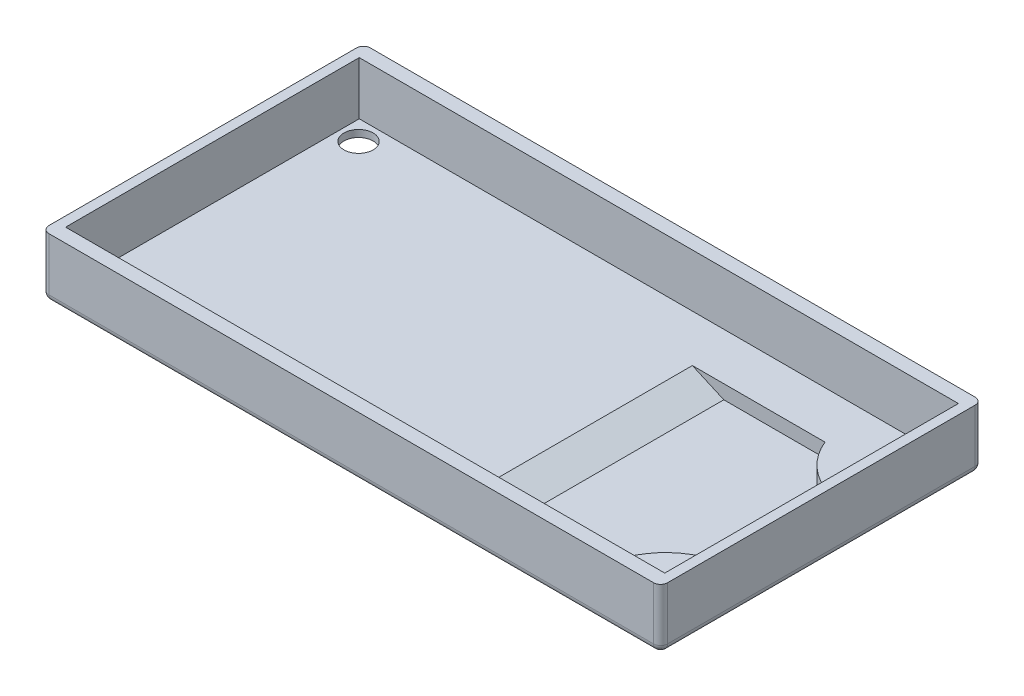
from build123d import *

# Parameters (mm, degrees)
BOTTOM_COVER_SKETCH_01_W                   = 44.37
BOTTOM_COVER_SKETCH_01_H                   = 23.06
BOTTOM_COVER_EXT_SHAPE_DEPTH               = 4.3
SALIENTE_EXTRUIR1_DEPTH                    = 1.4
CORTAR_EXTRUIR1_DEPTH                      = 30.966091253
CORTAR_EXTRUIR1_DEPTH_BACK                 = 30.966091253
VACIADO2_START                             = 0.5
VACIADO2_OUTLINE_W                         = 42.97
VACIADO2_OUTLINE_H                         = 21.06
VACIADO2_DEPTH                             = 3.8
SALIENTE_EXTRUIR2_DEPTH                    = 1.4
CORTAR_EXTRUIR2_DEPTH                      = 30.933277886
CORTAR_EXTRUIR2_DEPTH_BACK                 = 30.933277886
BOTTOM_POWER_TAKE_OFF_SHAFT_SKETCH_R       = 3
POWER_TAKE_OFF_SHAFT_EXTRUDE_01_DEPTH      = 3.9
BOTTOM_POWER_TAKE_OFF_SHAFT_SKETCH_3_R     = 4
BOTTOM_POWER_TAKE_OFF_SHAFT_SKETCH_3_R_2   = 3
POWER_TAKE_OFF_SHAFT_EXTRUDE_02_DEPTH      = 1
POWER_TAKE_OFF_SHAFT_CUT_DEPTH             = 1
POWER_TAKE_OFF_SHAFT_BOTTOM_COVER_SKETCH_R = 1
CORTAR_EXTRUIR4_DEPTH                      = 4.2
REDONDEO1_R                                = 0.5
REDONDEO2_R                                = 0.3
BOTTOM_COVER_SKETCH_01_33_R                = 1.05
CORTAR_EXTRUIR5_DEPTH                      = 0.5


with BuildPart() as part:
    # bottom-cover-sketch-01 → Bottom-cover-ext-shape (new body)
    with BuildSketch(Plane(origin=(0, 0, 0), x_dir=(1, 0, 0), z_dir=(0, 1, 0))):
        Rectangle(BOTTOM_COVER_SKETCH_01_W, BOTTOM_COVER_SKETCH_01_H)
    extrude(amount=BOTTOM_COVER_EXT_SHAPE_DEPTH)

    # bottom-cover-sketch-01<31> → Saliente-Extruir1 (add)
    with BuildSketch(Plane(origin=(0, 0, 0), x_dir=(1, 0, 0), z_dir=(0, 1, 0))):
        with BuildLine():
            Line((4.447, 8.15), (16.025784389, 8.15))
            ThreePointArc((16.025784389, 8.15), (17.087381076, 6.195438755), (19, 5.06001547))
            Line((19, 5.06001547), (19, -5.06001547))
            ThreePointArc((19, -5.06001547), (17.087381076, -6.195438755), (16.025784389, -8.15))
            Line((16.025784389, -8.15), (4.447, -8.15))
            Line((4.447, -8.15), (4.447, 8.15))
        make_face()
    extrude(amount=-SALIENTE_EXTRUIR1_DEPTH)

    # Croquis3 → Cortar-Extruir1 (cut, two sides: drawn at the far end of the back side and taken through both)
    with BuildSketch(Plane.XY.offset(8.15).offset(-CORTAR_EXTRUIR1_DEPTH_BACK)):
        Polygon((4.447, -1.4), (7.603, -1.4), (4.447, 0), align=None)
    extrude(amount=CORTAR_EXTRUIR1_DEPTH + CORTAR_EXTRUIR1_DEPTH_BACK, mode=Mode.SUBTRACT)

    # Vaciado2: read off the stored shape, not the designer's step
    # Vaciado2 outline → Vaciado2 (cut)
    with BuildSketch(Plane(origin=(0, 0, 0), x_dir=(1, 0, 0), z_dir=(0, 1, 0)).offset(VACIADO2_START)):
        Rectangle(VACIADO2_OUTLINE_W, VACIADO2_OUTLINE_H)
    extrude(amount=VACIADO2_DEPTH, mode=Mode.SUBTRACT)

    # Vaciado2 2: loft between two sections, ruled curve by curve
    vaciado2_2_from = [
        Edge.make_three_point_arc((15.297011486, -0.5, -7.15), (16.377210633, -0.5, -5.491282779), (18, -0.5, -4.357824492)),
        Edge.make_three_point_arc((18, -0.5, 4.357824492), (16.377210633, -0.5, 5.491282779), (15.297011486, -0.5, 7.15)),
        Edge.make_line((8.040274257, -0.5, -7.15), (15.297011486, -0.5, -7.15)),
        Edge.make_line((15.297011486, -0.5, 7.15), (8.040274257, -0.5, 7.15)),
        Edge.make_line((18, -0.5, -4.357824492), (18, -0.5, 4.357824492)),
        Edge.make_line((8.040274257, -0.5, 7.15), (8.040274257, -0.5, -7.15)),
    ]
    vaciado2_2_to = [
        Edge.make_three_point_arc((15.297011486, 0.5, -7.15), (16.377210633, 0.5, -5.491282779), (18, 0.5, -4.357824492)),
        Edge.make_three_point_arc((18, 0.5, 4.357824492), (16.377210633, 0.5, 5.491282779), (15.297011486, 0.5, 7.15)),
        Edge.make_line((5.785988543, 0.5, -7.15), (15.297011486, 0.5, -7.15)),
        Edge.make_line((15.297011486, 0.5, 7.15), (5.785988543, 0.5, 7.15)),
        Edge.make_line((18, 0.5, -4.357824492), (18, 0.5, 4.357824492)),
        Edge.make_line((5.785988543, 0.5, 7.15), (5.785988543, 0.5, -7.15)),
    ]
    vaciado2_2 = Solid(Shell([*[Face.make_surface_from_curves(vaciado2_2_from[k], vaciado2_2_to[k]) for k in range(6)], Face(Wire(vaciado2_2_from)), Face(Wire(vaciado2_2_to))]))
    add(vaciado2_2, mode=Mode.SUBTRACT)

    # bottom-cover-sketch-01<32> → Saliente-Extruir2 (add)
    with BuildSketch(Plane(origin=(0, 0, 0), x_dir=(1, 0, 0), z_dir=(0, 1, 0))):
        with BuildLine():
            Line((-1.8, -8.085967922), (-15.968544519, -8.085967922))
            ThreePointArc((-15.968544519, -8.085967922), (-17.060455349, -6.121867553), (-19, -4.986911136))
            Line((-19, -4.986911136), (-19, 5.04796656))
            ThreePointArc((-19, 5.04796656), (-17.09705221, 6.168745986), (-16.025784389, 8.1))
            Line((-16.025784389, 8.1), (-1.8, 8.1))
            Line((-1.8, 8.1), (-1.8, -8.085967922))
        make_face()
    extrude(amount=-SALIENTE_EXTRUIR2_DEPTH)

    # Croquis4 → Cortar-Extruir2 (cut, two sides: drawn at the far end of the back side and taken through both)
    with BuildSketch(Plane(origin=(0, 0, -8.1), x_dir=(-1, 0, 0), z_dir=(0, 0, -1)).offset(-CORTAR_EXTRUIR2_DEPTH_BACK)):
        Polygon((1.8, -1.4), (4.8, -1.4), (1.8, 0), align=None)
    extrude(amount=CORTAR_EXTRUIR2_DEPTH + CORTAR_EXTRUIR2_DEPTH_BACK, mode=Mode.SUBTRACT)

    # Bottom-power-take-off-shaft-sketch → Power-take-off-shaft-extrude-01 (add)
    with BuildSketch(Plane.XZ.offset(1.4)):
        with Locations(Location((-11.9, -0.018771875, 0), (0, 0, 270))):
            Circle(BOTTOM_POWER_TAKE_OFF_SHAFT_SKETCH_R)
    extrude(amount=POWER_TAKE_OFF_SHAFT_EXTRUDE_01_DEPTH)

    # Bottom-power-take-off-shaft-sketch<3> → Power-take-off-shaft-extrude-02 (add)
    with BuildSketch(Plane.XZ.offset(1.4)):
        with Locations(Location((-11.9, -0.018771875, 0), (0, 0, 90))):
            Circle(BOTTOM_POWER_TAKE_OFF_SHAFT_SKETCH_3_R)
        with Locations(Location((-11.9, -0.018771875, 0), (0, 0, 270))):
            Circle(BOTTOM_POWER_TAKE_OFF_SHAFT_SKETCH_3_R_2, mode=Mode.SUBTRACT)
    extrude(amount=POWER_TAKE_OFF_SHAFT_EXTRUDE_02_DEPTH)

    # Bottom-power-take-off-shaft-sketch<4> → Power-take-off-shaft-cut (cut)
    with BuildSketch(Plane.XZ.offset(1.4)):
        with BuildLine():
            Line((-13.454482392, -5.041059169), (-13.454482392, -6.345663941))
            ThreePointArc((-13.454482392, -6.345663941), (-13.609767702, -6.653654843), (-13.949729169, -6.711948276))
            ThreePointArc((-13.949729169, -6.711948276), (-16.710183373, -5.104254736), (-18.468864278, -2.437453767))
            ThreePointArc((-18.468864278, -2.437453767), (-18.423589426, -2.085954505), (-18.109382928, -1.922016039))
            Line((-18.109382928, -1.922016039), (-16.773422083, -1.922016039))
            ThreePointArc((-16.773422083, -1.922016039), (-16.567971503, -1.981769919), (-16.426615215, -2.142390177))
            ThreePointArc((-16.426615215, -2.142390177), (-15.30881206, -3.676640153), (-13.699675431, -4.68365862))
            ThreePointArc((-13.699675431, -4.68365862), (-13.521673241, -4.824348083), (-13.454482392, -5.041059169))
        make_face()
        with BuildLine():
            ThreePointArc((-18.070283639, 1.987983961), (-18.386311386, 2.15455721), (-18.427501404, 2.509414316))
            ThreePointArc((-18.427501404, 2.509414316), (-16.667494828, 5.106751812), (-13.949729169, 6.674404526))
            ThreePointArc((-13.949729169, 6.674404526), (-13.609767702, 6.616111093), (-13.454482392, 6.30812019))
            Line((-13.454482392, 6.30812019), (-13.454482392, 5.003515418))
            ThreePointArc((-13.454482392, 5.003515418), (-13.521673241, 4.786804333), (-13.699675431, 4.64611487))
            ThreePointArc((-13.699675431, 4.64611487), (-15.269573485, 3.675273946), (-16.380250969, 2.200991908))
            ThreePointArc((-16.380250969, 2.200991908), (-16.52151792, 2.045563265), (-16.723505638, 1.987983961))
            Line((-16.723505638, 1.987983961), (-18.070283639, 1.987983961))
        make_face()
        with BuildLine():
            ThreePointArc((-5.372498596, 2.509414316), (-6.810764187, 4.78744065), (-9.002861085, 6.353557848))
            ThreePointArc((-9.002861085, 6.353557848), (-9.368785516, 6.326920146), (-9.544482392, 6.00483186))
            Line((-9.544482392, 6.00483186), (-9.544482392, 4.615622196))
            ThreePointArc((-9.544482392, 4.615622196), (-9.494125288, 4.425766238), (-9.356293346, 4.285825255))
            ThreePointArc((-9.356293346, 4.285825255), (-8.236582512, 3.384075801), (-7.419749031, 2.200991908))
            ThreePointArc((-7.419749031, 2.200991908), (-7.27848208, 2.045563265), (-7.076494362, 1.987983961))
            Line((-7.076494362, 1.987983961), (-5.729716361, 1.987983961))
            ThreePointArc((-5.729716361, 1.987983961), (-5.413688614, 2.15455721), (-5.372498596, 2.509414316))
        make_face()
        with BuildLine():
            Line((-7.026577917, -1.922016039), (-5.690617072, -1.922016039))
            ThreePointArc((-5.690617072, -1.922016039), (-5.376410574, -2.085954505), (-5.331135722, -2.437453767))
            ThreePointArc((-5.331135722, -2.437453767), (-6.770756692, -4.782264616), (-9.002861085, -6.391101599))
            ThreePointArc((-9.002861085, -6.391101599), (-9.368785516, -6.364463896), (-9.544482392, -6.04237561))
            Line((-9.544482392, -6.04237561), (-9.544482392, -4.653165946))
            ThreePointArc((-9.544482392, -4.653165946), (-9.494125288, -4.463309988), (-9.356293346, -4.323369006))
            ThreePointArc((-9.356293346, -4.323369006), (-8.200468949, -3.382322083), (-7.373384785, -2.142390177))
            ThreePointArc((-7.373384785, -2.142390177), (-7.232028497, -1.981769919), (-7.026577917, -1.922016039))
        make_face()
    extrude(amount=-POWER_TAKE_OFF_SHAFT_CUT_DEPTH, mode=Mode.SUBTRACT)

    # Power-take-off-shaft-bottom-cover-sketch → Cortar-Extruir4 (cut)
    with BuildSketch(Plane.XZ.offset(5.3)):
        with Locations(Location((-11.9, -0.018771875, 0), (0, 0, 270))):
            Circle(POWER_TAKE_OFF_SHAFT_BOTTOM_COVER_SKETCH_R)
    extrude(amount=-CORTAR_EXTRUIR4_DEPTH, mode=Mode.SUBTRACT)

    # Redondeo1
    redondeo1_edges = [part.edges().sort_by_distance(p)[0] for p in [
        (0, 0, -11.53),
        (22.185, 0, 0),
        (0, 0, 11.53),
        (-22.185, 0, 0),
        (-22.185, 2.15, -11.53),
        (22.185, 2.15, -11.53),
        (22.185, 2.15, 11.53),
        (-22.185, 2.15, 11.53),
    ]]
    fillet(redondeo1_edges, radius=REDONDEO1_R)

    # Redondeo2
    redondeo2_edges = [part.edges().sort_by_distance(p)[0] for p in [
        (-11.9, -2.4, -4.018771875),
        (16.025784389, -0.7, -8.15),
        (19, -0.7, -5.06001547),
        (19, -0.7, 5.06001547),
        (16.025784389, -0.7, 8.15),
        (17.087381076, -1.4, -6.195438755),
        (19, -1.4, 0),
        (17.087381076, -1.4, 6.195438755),
        (11.814392195, -1.4, -8.15),
        (11.814392195, -1.4, 8.15),
        (7.603, -1.4, 0),
        (6.025, -0.7, -8.15),
        (6.025, -0.7, 8.15),
        (-17.060455349, -1.4, 6.121867553),
        (-15.968544519, -0.7, 8.085967922),
        (-19, -0.7, 4.986911136),
        (-19, -0.7, -5.04796656),
        (-16.025784389, -0.7, -8.1),
        (-19, -1.4, -0.030527712),
        (-17.09705221, -1.4, -6.168745986),
        (-10.38427226, -1.4, 8.085967922),
        (-10.412892195, -1.4, -8.1),
        (-4.8, -1.4, -0.007016039),
        (-3.3, -0.7, 8.085967922),
        (-3.3, -0.7, -8.1),
        (-11.9, -5.3, 2.981228125),
    ]]
    fillet(redondeo2_edges, radius=REDONDEO2_R)

    # Chaflán1: read off the stored shape, not the designer's step
    # Chaflán1 outline → Chaflán1 (revolve, cut)
    with BuildSketch(Plane(origin=(-11.9, 0, -0.018771875), x_dir=(1, 0, 0), z_dir=(0, 0, 1))):
        Polygon((1.3, -5.3), (1, -5), (1, -5.3), align=None)
    revolve(axis=Axis((-11.9, 0, -0.018771875), (0, 1, 0)), mode=Mode.SUBTRACT)

    # bottom-cover-sketch-01<33> → Cortar-Extruir5 (cut)
    with BuildSketch(Plane(origin=(0, 0, 0), x_dir=(1, 0, 0), z_dir=(0, 1, 0))):
        with Locations(Location((-20.105, 9.1, 0), (0, 0, 90))):
            Circle(BOTTOM_COVER_SKETCH_01_33_R)
        with Locations(Location((20.105, 9.1, 0), (0, 0, 90))):
            Circle(BOTTOM_COVER_SKETCH_01_33_R)
        with Locations(Location((20.105, -9.1, 0), (0, 0, 90))):
            Circle(BOTTOM_COVER_SKETCH_01_33_R)
        with Locations(Location((-20.105, -9.1, 0), (0, 0, 90))):
            Circle(BOTTOM_COVER_SKETCH_01_33_R)
    extrude(amount=CORTAR_EXTRUIR5_DEPTH, mode=Mode.SUBTRACT)


solid = part.part
